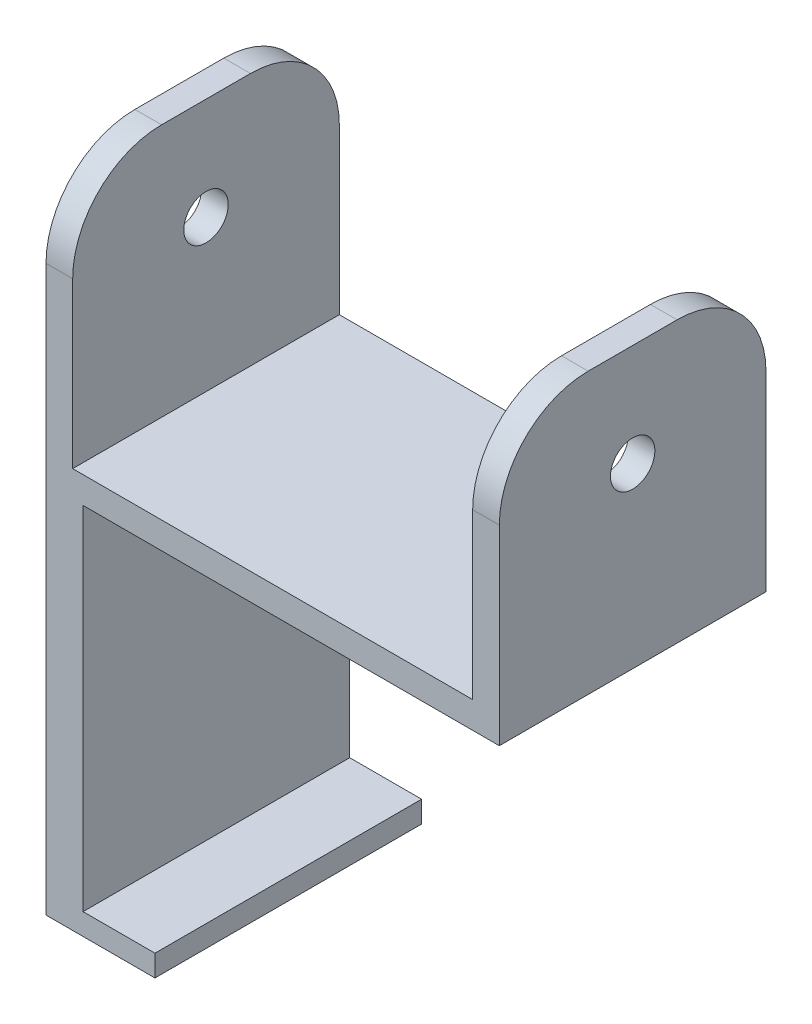
from build123d import *

# Parameters (mm, degrees)
EXTRUDE_THIN1_DEPTH = 15
FILLET1_R           = 10
SKETCH2_R           = 2.5
CUT_EXTRUDE1_DEPTH  = 55
BOSS_EXTRUDE1_DEPTH = 30


with BuildPart() as part:
    # Sketch1 → Extrude-Thin1 (new, symmetric)
    with BuildSketch(Plane.XY):
        Polygon((-23.321428571, 30), (-23.321428571, -1.5), (27.678571429, -1.5), (27.678571429, 30), (24.678571429, 30), (24.678571429, 1.5), (-20.321428571, 1.5), (-20.321428571, 30), align=None)
    extrude(amount=EXTRUDE_THIN1_DEPTH, both=True)

    # Fillet1
    fillet1_edges = [part.edges().sort_by_distance(p)[0] for p in [
        (26.178571429, 30, 15),
        (26.178571429, 30, -15),
        (-21.821428571, 30, -15),
        (-21.821428571, 30, 15),
    ]]
    fillet(fillet1_edges, radius=FILLET1_R)

    # Sketch2 → Cut-Extrude1 (cut)
    with BuildSketch(Plane(origin=(27.678571429, 0, 0), x_dir=(0, 0, -1), z_dir=(1, 0, 0))):
        with Locations((0, 18.5)):
            Circle(SKETCH2_R)
    extrude(amount=-CUT_EXTRUDE1_DEPTH, mode=Mode.SUBTRACT)

    # Sketch4 → Boss-Extrude1 (add)
    with BuildSketch(Plane(origin=(0, 0, -15), x_dir=(-1, 0, 0), z_dir=(0, 0, -1))):
        Polygon((23.321428571, -1.5), (23.321428571, -43.5), (11.065130386, -43.5), (11.065130386, -41.079631184), (19.153220087, -41.079631184), (19.153220087, -1.5), align=None)
    extrude(amount=-BOSS_EXTRUDE1_DEPTH)


solid = part.part
